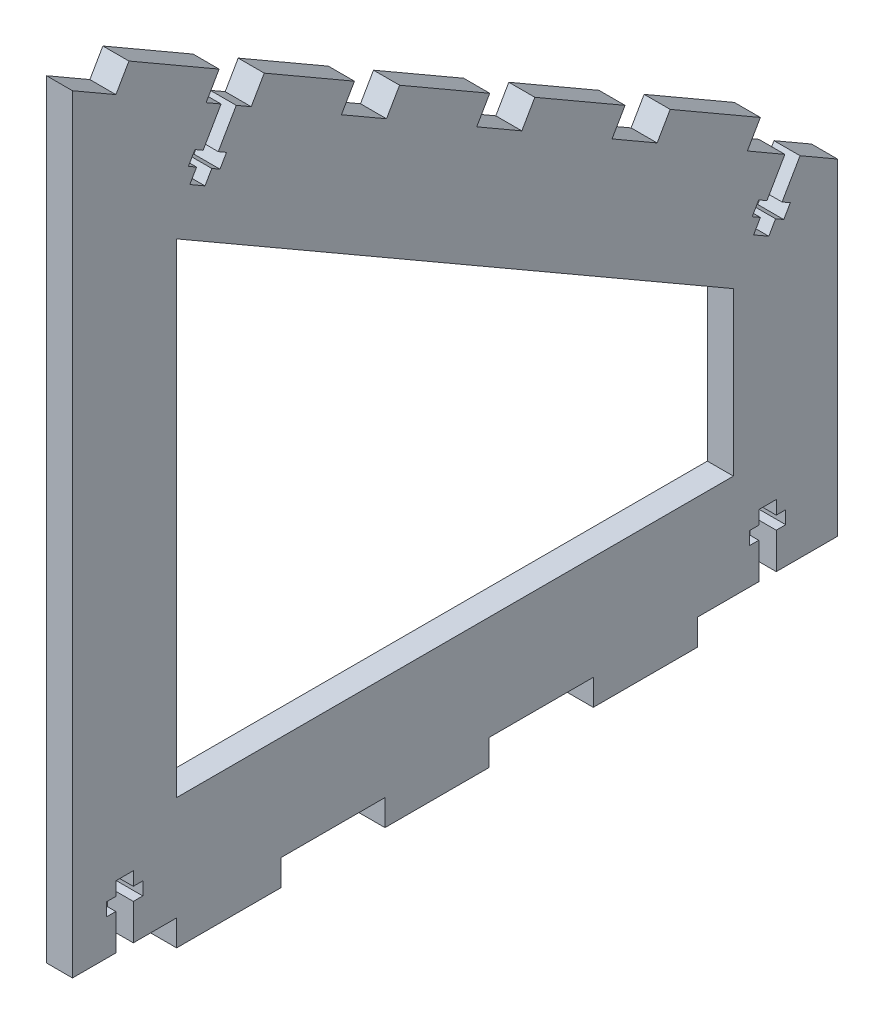
from build123d import *

# Parameters (mm, degrees)
BOSS_EXTRUDE1_DEPTH = 3.175
CUT_EXTRUDE1_DEPTH  = 6.35
SKETCH3_W           = 6.35
SKETCH3_H           = 25.4
BOSS_EXTRUDE2_DEPTH = 6.35
LPATTERN1_COUNT     = 5
LPATTERN1_PITCH     = 38.1
SKETCH4_W           = 6.35
SKETCH4_H           = 25.4
BOSS_EXTRUDE3_DEPTH = 6.35
LPATTERN2_COUNT     = 3
LPATTERN2_PITCH     = 50.8
CUT_EXTRUDE2_DEPTH  = 6.35
CUT_EXTRUDE3_DEPTH  = 6.35


with BuildPart() as part:
    # Sketch1 → Boss-Extrude1 (new, symmetric)
    with BuildSketch(Plane.ZY.offset(32.038437852)):
        Polygon((-215.9, 95.25), (-215.9, 174.9125), (-29.333338138, 282.626812448), (-29.333338138, 95.25), align=None)
    extrude(amount=BOSS_EXTRUDE1_DEPTH, both=True)

    # Sketch2 → Cut-Extrude1 (cut)
    with BuildSketch(Plane.ZY.offset(35.213437852)):
        Polygon((-190.5, 160.247803163), (-190.5, 120.65), (-54.733338138, 120.65), (-54.733338138, 238.632721936), align=None)
    extrude(amount=-CUT_EXTRUDE1_DEPTH, mode=Mode.SUBTRACT)

    # Sketch3 → Boss-Extrude2 (add)
    with BuildSketch(Plane(origin=(0, 224.671817339, -129.71433422), x_dir=(1, 0, 0), z_dir=(0, 0.8660254037844386, -0.5000000000000001))):
        with Locations((-32.038437852, 61.418634677)):
            Rectangle(SKETCH3_W, SKETCH3_H)
    boss_extrude2 = extrude(amount=BOSS_EXTRUDE2_DEPTH)

    # LPattern1: Boss-Extrude2 ×5
    with Locations(*[Vector(0, 0.5000000000000002, 0.8660254037844386) * (i * LPATTERN1_PITCH) for i in range(1, LPATTERN1_COUNT)]):
        add(boss_extrude2)

    # Sketch4 → Boss-Extrude3 (add)
    with BuildSketch(Plane.XZ.offset(-95.25)):
        with Locations((-32.038437852, -67.433338138)):
            Rectangle(SKETCH4_W, SKETCH4_H)
    boss_extrude3 = extrude(amount=BOSS_EXTRUDE3_DEPTH)

    # LPattern2: Boss-Extrude3 ×3
    with Locations(*[(0, 0, -i * LPATTERN2_PITCH) for i in range(1, LPATTERN2_COUNT)]):
        add(boss_extrude3)

    # Sketch5 → Cut-Extrude2 (cut)
    with BuildSketch(Plane(origin=(-28.863437852, 0, 0), x_dir=(0, 0, -1), z_dir=(1, 0, 0))):
        Polygon((196.683069069, 95.25), (200.950269069, 95.25), (200.950269069, 104.013), (203.261669069, 104.013), (203.261669069, 107.188), (200.950269069, 107.188), (200.950269069, 110.49), (196.683069069, 110.49), (196.683069069, 107.188), (194.371669069, 107.188), (194.371669069, 104.013), (196.683069069, 104.013), align=None)
        Polygon((39.899738138, 95.25), (44.166938138, 95.25), (44.166938138, 104.013), (46.478338138, 104.013), (46.478338138, 107.188), (44.166938138, 107.188), (44.166938138, 110.49), (39.899738138, 110.49), (39.899738138, 107.188), (37.588338138, 107.188), (37.588338138, 104.013), (39.899738138, 104.013), align=None)
    extrude(amount=-CUT_EXTRUDE2_DEPTH, mode=Mode.SUBTRACT)

    # Sketch6 → Cut-Extrude3 (cut)
    with BuildSketch(Plane(origin=(-28.863437852, 0, 0), x_dir=(0, 0, -1), z_dir=(1, 0, 0))):
        Polygon((206.749229173, 180.1957), (203.05372557, 182.3293), (198.67222557, 174.740319387), (196.670494452, 175.896019387), (195.082994452, 173.14638873), (197.08472557, 171.99068873), (195.43372557, 169.131072846), (199.129229173, 166.997472846), (200.780229173, 169.85708873), (202.781960292, 168.70138873), (204.369460292, 171.451019387), (202.367729173, 172.606719387), align=None)
        Polygon((69.267696323, 259.5707), (65.57219272, 261.7043), (61.19069272, 254.115319387), (59.188961601, 255.271019387), (57.601461601, 252.52138873), (59.60319272, 251.36568873), (57.95219272, 248.506072846), (61.647696323, 246.372472846), (63.298696323, 249.23208873), (65.300427441, 248.07638873), (66.887927441, 250.826019387), (64.886196323, 251.981719387), align=None)
    extrude(amount=-CUT_EXTRUDE3_DEPTH, mode=Mode.SUBTRACT)


solid = part.part
